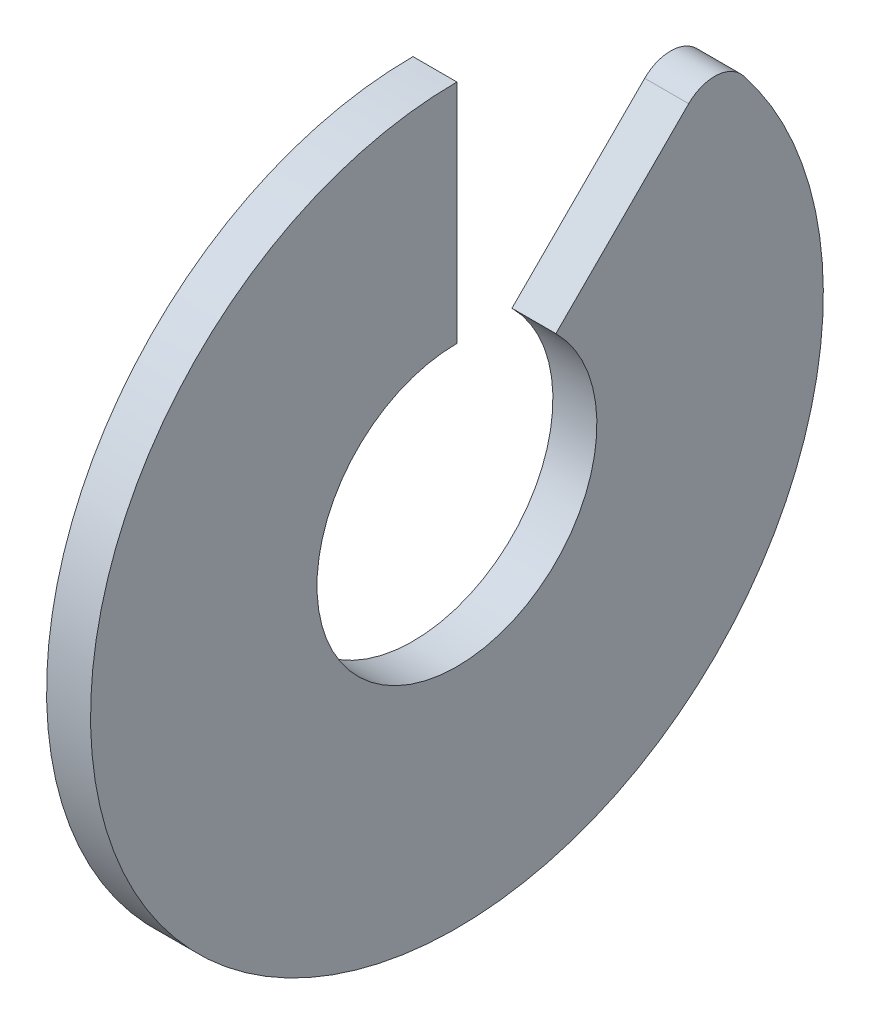
from build123d import *

# Parameters (mm, degrees)
SM_BASE_FLANGE_1_DEPTH = 12
FILLET_1_R             = 10


# Sheet-metal steps are written as plain solids
with BuildPart() as part:
    # Sketch 1 → Базовая кромка1 (new body)
    with BuildSketch(Plane(origin=(0, 0, 0), x_dir=(0, 0, -1), z_dir=(1, 0, 0))):
        with BuildLine():
            Line((0, 38.2), (0, 100))
            ThreePointArc((0, 100), (-38.268343237, -92.387953251), (70.710678119, 70.710678119))
            Line((70.710678119, 70.710678119), (27.011479041, 27.011479041))
            ThreePointArc((27.011479041, 27.011479041), (-14.618507116, -35.292198142), (0, 38.2))
        make_face()
    extrude(amount=-SM_BASE_FLANGE_1_DEPTH)

    # Скругление1
    fillet_1_edges = [part.edges().sort_by_distance(p)[0] for p in [
        (-6, 70.710678119, -70.710678119),
    ]]
    fillet(fillet_1_edges, radius=FILLET_1_R)


solid = part.part
